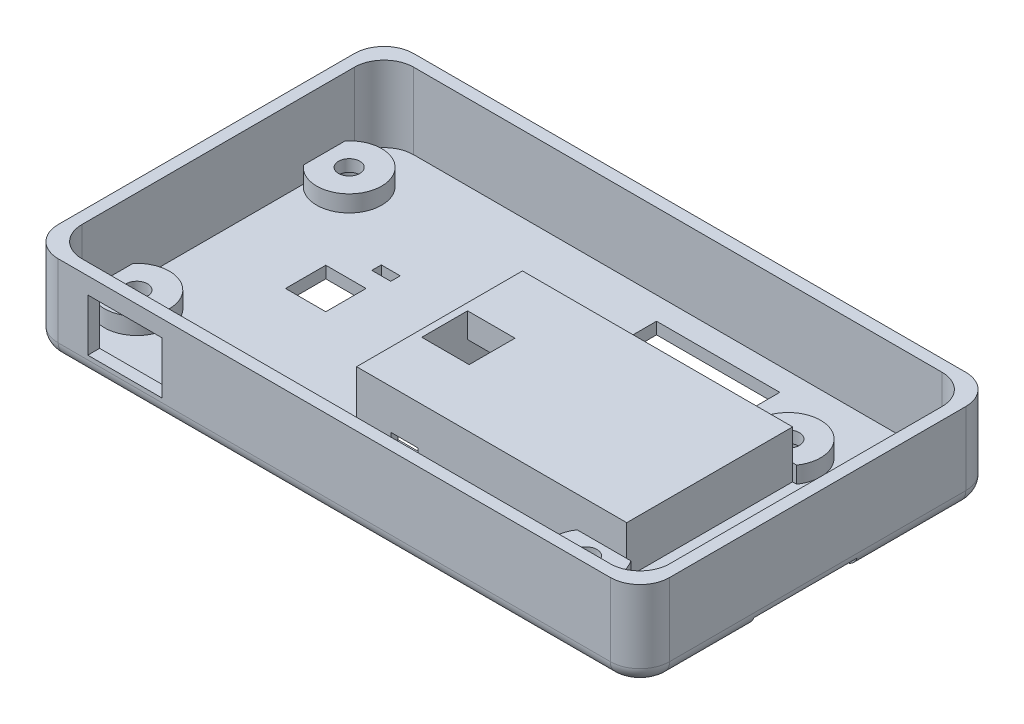
from build123d import *

# Parameters (mm, degrees)
SKETCH_1_W           = 123.84
SKETCH_1_H           = 72
EXTRUDE_1_DEPTH      = 17.76
SKETCH_8_W           = 119.04
SKETCH_8_H           = 67.2
CUT_EXTRUDE_5_DEPTH  = 15.36
SKETCH_10_W          = 54.72
SKETCH_10_H          = 33.6
EXTRUDE_2_DEPTH      = 9.64
SKETCH_11_W          = 15
SKETCH_11_H          = 10.56
CUT_EXTRUDE_7_DEPTH  = 5
SKETCH_12_W          = 51.36
SKETCH_12_H          = 30.24
CUT_EXTRUDE_8_DEPTH  = 7
SKETCH_13_W          = 24.6
SKETCH_13_H          = 20.96
CUT_EXTRUDE_9_DEPTH  = 2
CUT_EXTRUDE_16_DEPTH = 73.428336996
FILLET_1_R           = 6
FILLET_3_R           = 3
FILLET_5_R           = 6
SKETCH_19_W          = 5.5
SKETCH_19_H          = 2
CUT_EXTRUDE_14_DEPTH = 3.84
SKETCH_20_W          = 5.5
SKETCH_20_H          = 2
CUT_EXTRUDE_15_DEPTH = 3.84
EXTRUDE_3_DEPTH      = 3.36
EXTRUDE_4_DEPTH      = 3.36
SKETCH_25_R          = 2.16
SKETCH_25_R_2        = 2.26
CUT_EXTRUDE_17_DEPTH = 74.793658264
SKETCH_22_R          = 3.71
SKETCH_22_R_2        = 3.12
CUT_EXTRUDE_18_DEPTH = 3.36
SKETCH_26_W          = 24.96
SKETCH_26_H          = 11.04
SKETCH_26_W_2        = 3.84
SKETCH_26_H_2        = 1.92
SKETCH_26_W_3        = 8.16
SKETCH_26_H_3        = 8.16
CUT_EXTRUDE_19_DEPTH = 74.793658264


with BuildPart() as part:
    # Эскиз1 → Бобышка-Вытянуть1 (new body)
    with BuildSketch(Plane(origin=(0, 0, 0), x_dir=(1, 0, 0), z_dir=(0, 1, 0))):
        Rectangle(SKETCH_1_W, SKETCH_1_H)
    extrude(amount=EXTRUDE_1_DEPTH)

    # Эскиз8 → Вырез-Вытянуть5 (cut)
    with BuildSketch(Plane(origin=(0, 17.76, 0), x_dir=(1, 0, 0), z_dir=(0, 1, 0))):
        Rectangle(SKETCH_8_W, SKETCH_8_H)
    extrude(amount=-CUT_EXTRUDE_5_DEPTH, mode=Mode.SUBTRACT)

    # Эскиз10 → Бобышка-Вытянуть2 (add)
    with BuildSketch(Plane(origin=(0, 2.4, 0), x_dir=(1, 0, 0), z_dir=(0, 1, 0))):
        with Locations((14.88, -2.2)):
            Rectangle(SKETCH_10_W, SKETCH_10_H)
    extrude(amount=EXTRUDE_2_DEPTH)

    # Эскиз11 → Вырез-Вытянуть7 (cut)
    with BuildSketch(Plane.XY.offset(33.6)):
        with Locations((-42.42, 9.12)):
            Rectangle(SKETCH_11_W, SKETCH_11_H)
    extrude(amount=CUT_EXTRUDE_7_DEPTH, mode=Mode.SUBTRACT)

    # Эскиз12 → Вырез-Вытянуть8 (cut)
    with BuildSketch(Plane.XZ):
        with Locations((14.64, 2.44)):
            Rectangle(SKETCH_12_W, SKETCH_12_H)
    extrude(amount=-CUT_EXTRUDE_8_DEPTH, mode=Mode.SUBTRACT)

    # Эскиз13 → Вырез-Вытянуть9 (cut)
    with BuildSketch(Plane.XZ):
        with Locations((49.62, 2.28)):
            Rectangle(SKETCH_13_W, SKETCH_13_H)
    extrude(amount=-CUT_EXTRUDE_9_DEPTH, mode=Mode.SUBTRACT)

    # Эскиз21 → Вырез-Вытянуть16 (cut, through all)
    with BuildSketch(Plane.XZ.offset(-7)):
        Polygon((-1.44, 7.24), (-1.44, -2.04), (-11.04, -2.04), (-11.04, 2.44), (-11.04, 7.24), align=None)
    extrude(amount=-CUT_EXTRUDE_16_DEPTH, mode=Mode.SUBTRACT)

    # Скругление1
    fillet_1_edges = [part.edges().sort_by_distance(p)[0] for p in [
        (-61.92, 8.88, -36),
        (61.92, 8.88, -36),
        (61.92, 8.88, 36),
        (-61.92, 8.88, 36),
    ]]
    fillet(fillet_1_edges, radius=FILLET_1_R)

    # Скругление3
    # the kernel refuses this fillet: 3 mm, written as the material it takes off along each edge
    with BuildSketch(Plane(origin=(55.92, 0, -30), x_dir=(1, 0, 0), z_dir=(0, 0, 1))) as fillet_3_piece_1:
        with BuildLine():
            CenterArc((6 - FILLET_3_R, FILLET_3_R), FILLET_3_R, 270, 90)
            Line((6, FILLET_3_R), (6 + FILLET_3_R * 0.02, FILLET_3_R))
            Line((6 + FILLET_3_R * 0.02, FILLET_3_R), (6 + FILLET_3_R * 0.02, -FILLET_3_R * 0.02))
            Line((6 + FILLET_3_R * 0.02, -FILLET_3_R * 0.02), (6 - FILLET_3_R, -FILLET_3_R * 0.02))
            Line((6 - FILLET_3_R, -FILLET_3_R * 0.02), (6 - FILLET_3_R, 0))
        make_face()
    revolve(axis=Axis((55.92, 0, -30), (0, 1, 0)), revolution_arc=90, mode=Mode.SUBTRACT)
    with BuildSketch(Plane(origin=(-55.92, 0, -36), x_dir=(0, 0, 1), z_dir=(1, 0, 0))) as fillet_3_piece_2:
        with BuildLine():
            CenterArc((FILLET_3_R, -FILLET_3_R), FILLET_3_R, 90, 90)
            Line((0, -FILLET_3_R), (-FILLET_3_R * 0.02, -FILLET_3_R))
            Line((-FILLET_3_R * 0.02, -FILLET_3_R), (-FILLET_3_R * 0.02, FILLET_3_R * 0.02))
            Line((-FILLET_3_R * 0.02, FILLET_3_R * 0.02), (FILLET_3_R, FILLET_3_R * 0.02))
            Line((FILLET_3_R, FILLET_3_R * 0.02), (FILLET_3_R, 0))
        make_face()
    extrude(amount=111.84, mode=Mode.SUBTRACT)
    with BuildSketch(Plane(origin=(-55.92, 0, -30), x_dir=(-1, 0, 0), z_dir=(0, 0, 1))) as fillet_3_piece_3:
        with BuildLine():
            CenterArc((6 - FILLET_3_R, -FILLET_3_R), FILLET_3_R, 0, 90)
            Line((6, -FILLET_3_R), (6 + FILLET_3_R * 0.02, -FILLET_3_R))
            Line((6 + FILLET_3_R * 0.02, -FILLET_3_R), (6 + FILLET_3_R * 0.02, FILLET_3_R * 0.02))
            Line((6 + FILLET_3_R * 0.02, FILLET_3_R * 0.02), (6 - FILLET_3_R, FILLET_3_R * 0.02))
            Line((6 - FILLET_3_R, FILLET_3_R * 0.02), (6 - FILLET_3_R, 0))
        make_face()
    revolve(axis=Axis((-55.92, 0, -30), (0, -1, 0)), revolution_arc=90, mode=Mode.SUBTRACT)
    with BuildSketch(Plane(origin=(-61.92, 0, 30), x_dir=(1, 0, 0), z_dir=(0, 0, -1))) as fillet_3_piece_4:
        with BuildLine():
            CenterArc((FILLET_3_R, -FILLET_3_R), FILLET_3_R, 90, 90)
            Line((0, -FILLET_3_R), (-FILLET_3_R * 0.02, -FILLET_3_R))
            Line((-FILLET_3_R * 0.02, -FILLET_3_R), (-FILLET_3_R * 0.02, FILLET_3_R * 0.02))
            Line((-FILLET_3_R * 0.02, FILLET_3_R * 0.02), (FILLET_3_R, FILLET_3_R * 0.02))
            Line((FILLET_3_R, FILLET_3_R * 0.02), (FILLET_3_R, 0))
        make_face()
    extrude(amount=60, mode=Mode.SUBTRACT)
    with BuildSketch(Plane(origin=(-55.92, 0, 30), x_dir=(0, 0, 1), z_dir=(1, 0, 0))) as fillet_3_piece_5:
        with BuildLine():
            CenterArc((6 - FILLET_3_R, -FILLET_3_R), FILLET_3_R, 0, 90)
            Line((6, -FILLET_3_R), (6 + FILLET_3_R * 0.02, -FILLET_3_R))
            Line((6 + FILLET_3_R * 0.02, -FILLET_3_R), (6 + FILLET_3_R * 0.02, FILLET_3_R * 0.02))
            Line((6 + FILLET_3_R * 0.02, FILLET_3_R * 0.02), (6 - FILLET_3_R, FILLET_3_R * 0.02))
            Line((6 - FILLET_3_R, FILLET_3_R * 0.02), (6 - FILLET_3_R, 0))
        make_face()
    revolve(axis=Axis((-55.92, 0, 30), (0, -1, 0)), revolution_arc=90, mode=Mode.SUBTRACT)
    with BuildSketch(Plane(origin=(61.92, 0, -5.24), x_dir=(-1, 0, 0), z_dir=(0, 0, 1))) as fillet_3_piece_6:
        with BuildLine():
            CenterArc((FILLET_3_R, -FILLET_3_R), FILLET_3_R, 90, 90)
            Line((0, -FILLET_3_R), (-FILLET_3_R * 0.02, -FILLET_3_R))
            Line((-FILLET_3_R * 0.02, -FILLET_3_R), (-FILLET_3_R * 0.02, FILLET_3_R * 0.02))
            Line((-FILLET_3_R * 0.02, FILLET_3_R * 0.02), (FILLET_3_R, FILLET_3_R * 0.02))
            Line((FILLET_3_R, FILLET_3_R * 0.02), (FILLET_3_R, 0))
        make_face()
    extrude(amount=35.24, mode=Mode.SUBTRACT)
    with BuildSketch(Plane(origin=(55.92, 0, 30), x_dir=(0, 0, 1), z_dir=(-1, 0, 0))) as fillet_3_piece_7:
        with BuildLine():
            CenterArc((6 - FILLET_3_R, FILLET_3_R), FILLET_3_R, 270, 90)
            Line((6, FILLET_3_R), (6 + FILLET_3_R * 0.02, FILLET_3_R))
            Line((6 + FILLET_3_R * 0.02, FILLET_3_R), (6 + FILLET_3_R * 0.02, -FILLET_3_R * 0.02))
            Line((6 + FILLET_3_R * 0.02, -FILLET_3_R * 0.02), (6 - FILLET_3_R, -FILLET_3_R * 0.02))
            Line((6 - FILLET_3_R, -FILLET_3_R * 0.02), (6 - FILLET_3_R, 0))
        make_face()
    revolve(axis=Axis((55.92, 0, 30), (0, 1, 0)), revolution_arc=90, mode=Mode.SUBTRACT)
    with BuildSketch(Plane(origin=(55.92, 0, 36), x_dir=(0, 1, 0), z_dir=(-1, 0, 0))) as fillet_3_piece_8:
        with BuildLine():
            CenterArc((FILLET_3_R, FILLET_3_R), FILLET_3_R, 180, 90)
            Line((0, FILLET_3_R), (-FILLET_3_R * 0.02, FILLET_3_R))
            Line((-FILLET_3_R * 0.02, FILLET_3_R), (-FILLET_3_R * 0.02, -FILLET_3_R * 0.02))
            Line((-FILLET_3_R * 0.02, -FILLET_3_R * 0.02), (FILLET_3_R, -FILLET_3_R * 0.02))
            Line((FILLET_3_R, -FILLET_3_R * 0.02), (FILLET_3_R, 0))
        make_face()
    extrude(amount=111.84, mode=Mode.SUBTRACT)
    with BuildSketch(Plane(origin=(61.92, 0, -30), x_dir=(-1, 0, 0), z_dir=(0, 0, 1))) as fillet_3_piece_9:
        with BuildLine():
            CenterArc((FILLET_3_R, -FILLET_3_R), FILLET_3_R, 90, 90)
            Line((0, -FILLET_3_R), (-FILLET_3_R * 0.02, -FILLET_3_R))
            Line((-FILLET_3_R * 0.02, -FILLET_3_R), (-FILLET_3_R * 0.02, FILLET_3_R * 0.02))
            Line((-FILLET_3_R * 0.02, FILLET_3_R * 0.02), (FILLET_3_R, FILLET_3_R * 0.02))
            Line((FILLET_3_R, FILLET_3_R * 0.02), (FILLET_3_R, 0))
        make_face()
    extrude(amount=39.8, mode=Mode.SUBTRACT)

    # Скругление5
    fillet_5_edges = [part.edges().sort_by_distance(p)[0] for p in [
        (-59.52, 10.08, 33.6),
        (-59.52, 10.08, -33.6),
        (59.52, 10.08, -33.6),
        (59.52, 10.08, 33.6),
    ]]
    fillet(fillet_5_edges, radius=FILLET_5_R)

    # Эскиз19 → Вырез-Вытянуть14 (cut)
    with BuildSketch(Plane(origin=(0, 0, 17.56), x_dir=(-1, 0, 0), z_dir=(0, 0, -1))):
        with Locations((2.75, 3)):
            Rectangle(SKETCH_19_W, SKETCH_19_H)
    extrude(amount=-CUT_EXTRUDE_14_DEPTH, mode=Mode.SUBTRACT)

    # Эскиз20 → Вырез-Вытянуть15 (cut)
    with BuildSketch(Plane.XY.offset(-12.68)):
        with Locations((-2.75, 3)):
            Rectangle(SKETCH_20_W, SKETCH_20_H)
    extrude(amount=-CUT_EXTRUDE_15_DEPTH, mode=Mode.SUBTRACT)

    # Эскиз24 → Бобышка-Вытянуть3 (add)
    with BuildSketch(Plane(origin=(0, 2.4, 0), x_dir=(1, 0, 0), z_dir=(0, 1, 0))):
        with BuildLine():
            Line((32.198823657, -19), (43.081176343, -19))
            ThreePointArc((43.081176343, -19), (37.64, -29.28), (32.198823657, -19))
        make_face()
        with BuildLine():
            Line((32.198823657, 14.6), (43.075947447, 14.592322107))
            ThreePointArc((43.075947447, 14.592322107), (37.644644658, 24.879998361), (32.198823657, 14.6))
        make_face()
    extrude(amount=EXTRUDE_3_DEPTH)

    # Эскиз23 → Бобышка-Вытянуть4 (add)
    with BuildSketch(Plane(origin=(0, 2.4, 0), x_dir=(1, 0, 0), z_dir=(0, 1, 0))):
        with BuildLine():
            Line((-59.52, 25.73022458), (-59.52, 17.26977542))
            ThreePointArc((-59.52, 17.26977542), (-47.9, 21.5), (-59.52, 25.73022458))
        make_face()
        with BuildLine():
            Line((-59.52, -25.73022458), (-59.52, -17.26977542))
            ThreePointArc((-59.52, -17.26977542), (-47.9, -21.5), (-59.52, -25.73022458))
        make_face()
    extrude(amount=EXTRUDE_4_DEPTH)

    # Эскиз25 → Вырез-Вытянуть17 (cut, through all)
    with BuildSketch(Plane(origin=(0, 0, 0), x_dir=(1, 0, 0), z_dir=(0, 1, 0))):
        with Locations(Location((-54.48, -21.5, 0), (0, 0, 270))):
            Circle(SKETCH_25_R)
        with Locations(Location((-54.48, 21.5, 0), (0, 0, 270))):
            Circle(SKETCH_25_R)
        with Locations(Location((37.64, 18.3, 0), (0, 0, 90))):
            Circle(SKETCH_25_R_2)
        with Locations(Location((37.64, -22.7, 0), (0, 0, 90))):
            Circle(SKETCH_25_R_2)
    extrude(amount=CUT_EXTRUDE_17_DEPTH, mode=Mode.SUBTRACT)

    # Эскиз22 → Вырез-Вытянуть18 (cut)
    with BuildSketch(Plane.XZ):
        with Locations(Location((37.64, -18.3, 0), (0, 0, 270))):
            Circle(SKETCH_22_R)
        with Locations(Location((37.64, 22.7, 0), (0, 0, 270))):
            Circle(SKETCH_22_R)
        with Locations(Location((-54.48, 21.5, 0), (0, 0, 90))):
            Circle(SKETCH_22_R_2)
        with Locations(Location((-54.48, -21.5, 0), (0, 0, 90))):
            Circle(SKETCH_22_R_2)
    extrude(amount=-CUT_EXTRUDE_18_DEPTH, mode=Mode.SUBTRACT)

    # Эскиз26 → Вырез-Вытянуть19 (cut, through all)
    with BuildSketch(Plane.XZ):
        with Locations((12.761591223, -23.48)):
            Rectangle(SKETCH_26_W, SKETCH_26_H)
        with Locations((-35.56, -10.04)):
            Rectangle(SKETCH_26_W_2, SKETCH_26_H_2)
        with Locations((-38.96, -1.24)):
            Rectangle(SKETCH_26_W_3, SKETCH_26_H_3)
    extrude(amount=-CUT_EXTRUDE_19_DEPTH, mode=Mode.SUBTRACT)


solid = part.part
